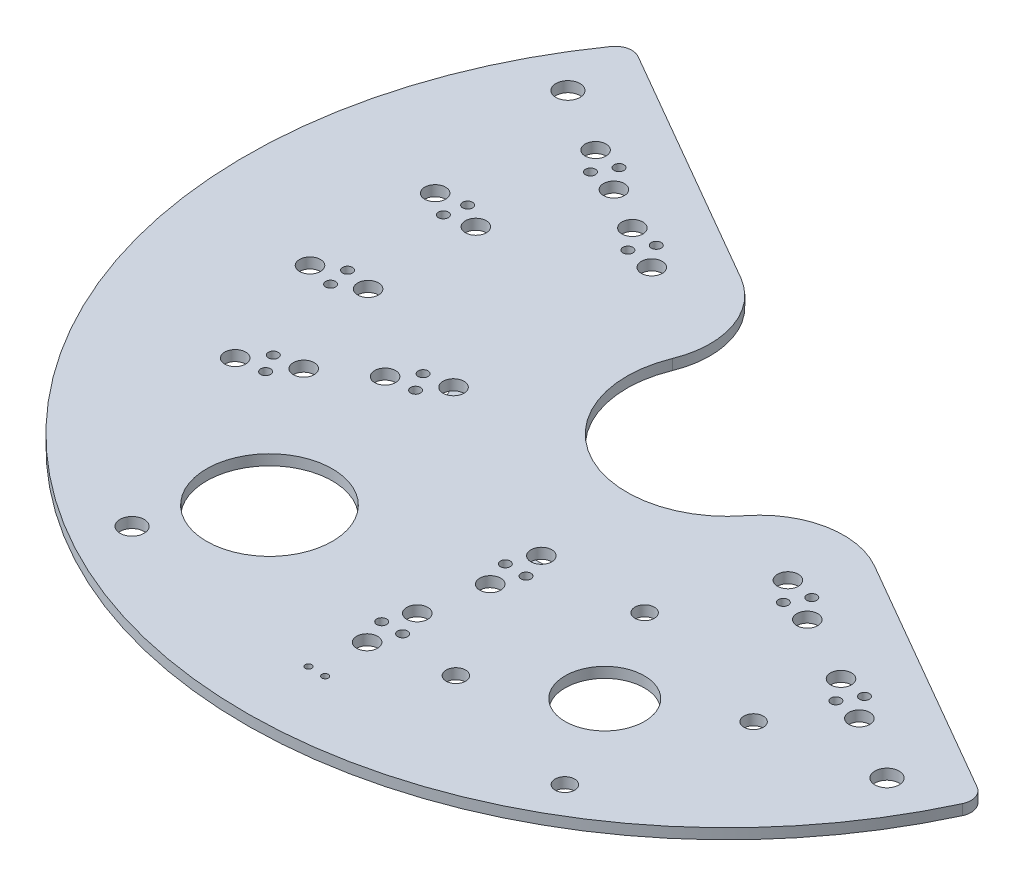
from build123d import *

# Parameters (mm, degrees)
SKETCH1_R           = 73.025
SKETCH1_R_2         = 15.24
SKETCH1_R_3         = 0.75
SKETCH1_R_4         = 1.585
SKETCH1_R_5         = 20
SKETCH1_R_6         = 9.525
SKETCH1_R_7         = 6
BOSS_EXTRUDE1_DEPTH = 1.5875
SKETCH2_R           = 1.8288
CUT_EXTRUDE1_DEPTH  = 104.285146107
CUT_EXTRUDE2_DEPTH  = 104.285146107
FILLET1_R           = 12.7
FILLET2_R           = 2.54
SKETCH4_R           = 0.4953
CUT_EXTRUDE3_DEPTH  = 104.285146107
SKETCH5_R           = 0.75
SKETCH5_R_2         = 0.4953
BOSS_EXTRUDE2_DEPTH = 0.1016
SKETCH6_R           = 1.4732
CUT_EXTRUDE4_DEPTH  = 104.285146107


with BuildPart() as part:
    # Sketch1 → Boss-Extrude1 (new body)
    with BuildSketch(Plane(origin=(0, 0, 0), x_dir=(1, 0, 0), z_dir=(0, 1, 0))):
        Circle(SKETCH1_R)
        Circle(SKETCH1_R_2, mode=Mode.SUBTRACT)
        with Locations((-1.585, 50.8)):
            Circle(SKETCH1_R_3, mode=Mode.SUBTRACT)
        with Locations((1.585, 50.8)):
            Circle(SKETCH1_R_3, mode=Mode.SUBTRACT)
        with Locations((0, 54.6)):
            Circle(SKETCH1_R_4, mode=Mode.SUBTRACT)
        with Locations((0, 47)):
            Circle(SKETCH1_R_4, mode=Mode.SUBTRACT)
        with Locations((47.284987047, 27.3)):
            Circle(SKETCH1_R_4, mode=Mode.SUBTRACT)
        with Locations((43.201590512, 26.772650265)):
            Circle(SKETCH1_R_3, mode=Mode.SUBTRACT)
        with Locations((44.786590512, 24.027349735)):
            Circle(SKETCH1_R_3, mode=Mode.SUBTRACT)
        with Locations((40.703193978, 23.5)):
            Circle(SKETCH1_R_4, mode=Mode.SUBTRACT)
        with Locations((47.284987047, -27.3)):
            Circle(SKETCH1_R_4, mode=Mode.SUBTRACT)
        with Locations((44.786590512, -24.027349735)):
            Circle(SKETCH1_R_3, mode=Mode.SUBTRACT)
        with Locations((43.201590512, -26.772650265)):
            Circle(SKETCH1_R_3, mode=Mode.SUBTRACT)
        with Locations((40.703193978, -23.5)):
            Circle(SKETCH1_R_4, mode=Mode.SUBTRACT)
        with Locations((0, -54.6)):
            Circle(SKETCH1_R_4, mode=Mode.SUBTRACT)
        with Locations((1.585, -50.8)):
            Circle(SKETCH1_R_3, mode=Mode.SUBTRACT)
        with Locations((-1.585, -50.8)):
            Circle(SKETCH1_R_3, mode=Mode.SUBTRACT)
        with Locations((0, -47)):
            Circle(SKETCH1_R_4, mode=Mode.SUBTRACT)
        with Locations((-47.284987047, -27.3)):
            Circle(SKETCH1_R_4, mode=Mode.SUBTRACT)
        with Locations((-43.201590512, -26.772650265)):
            Circle(SKETCH1_R_3, mode=Mode.SUBTRACT)
        with Locations((-44.786590512, -24.027349735)):
            Circle(SKETCH1_R_3, mode=Mode.SUBTRACT)
        with Locations((-40.703193978, -23.5)):
            Circle(SKETCH1_R_4, mode=Mode.SUBTRACT)
        with Locations((-47.284987047, 27.3)):
            Circle(SKETCH1_R_4, mode=Mode.SUBTRACT)
        with Locations((-44.786590512, 24.027349735)):
            Circle(SKETCH1_R_3, mode=Mode.SUBTRACT)
        with Locations((-43.201590512, 26.772650265)):
            Circle(SKETCH1_R_3, mode=Mode.SUBTRACT)
        with Locations((-40.703193978, 23.5)):
            Circle(SKETCH1_R_4, mode=Mode.SUBTRACT)
        with Locations((25.4, 43.994090512)):
            Circle(SKETCH1_R_5, mode=Mode.SUBTRACT)
        with Locations((-25.4, -43.994090512)):
            Circle(SKETCH1_R_6, mode=Mode.SUBTRACT)
        with Locations((25.4, -43.994090512)):
            Circle(SKETCH1_R_7, mode=Mode.SUBTRACT)
        with Locations((-46.285964392, 8.16146435)):
            Circle(SKETCH1_R_4, mode=Mode.SUBTRACT)
        with Locations((-50.303466215, 7.260407137)):
            Circle(SKETCH1_R_3, mode=Mode.SUBTRACT)
        with Locations((-49.753001491, 10.382247714)):
            Circle(SKETCH1_R_3, mode=Mode.SUBTRACT)
        with Locations((-53.770503314, 9.481190501)):
            Circle(SKETCH1_R_4, mode=Mode.SUBTRACT)
        with Locations((-46.285964392, -8.16146435)):
            Circle(SKETCH1_R_4, mode=Mode.SUBTRACT)
        with Locations((-49.753001491, -10.382247714)):
            Circle(SKETCH1_R_3, mode=Mode.SUBTRACT)
        with Locations((-50.303466215, -7.260407137)):
            Circle(SKETCH1_R_3, mode=Mode.SUBTRACT)
        with Locations((-53.770503314, -9.481190501)):
            Circle(SKETCH1_R_4, mode=Mode.SUBTRACT)
        with Locations((-29.397305699, -17.855276467)):
            Circle(SKETCH1_R_3, mode=Mode.SUBTRACT)
        with Locations((-31.002036221, -15.116847022)):
            Circle(SKETCH1_R_3, mode=Mode.SUBTRACT)
        with Locations((-33.503208801, -18.377965576)):
            Circle(SKETCH1_R_4, mode=Mode.SUBTRACT)
        with Locations((-26.914267425, -14.590346807)):
            Circle(SKETCH1_R_4, mode=Mode.SUBTRACT)
        with Locations((0.18310412, -33.841026905)):
            Circle(SKETCH1_R_3, mode=Mode.SUBTRACT)
        with Locations((3.356893615, -33.875899805)):
            Circle(SKETCH1_R_3, mode=Mode.SUBTRACT)
        with Locations((1.849768537, -30.052376234)):
            Circle(SKETCH1_R_4, mode=Mode.SUBTRACT)
        with Locations((1.702835812, -37.650969207)):
            Circle(SKETCH1_R_4, mode=Mode.SUBTRACT)
        with Locations((26.301300673, -17.833485437)):
            Circle(SKETCH1_R_3, mode=Mode.SUBTRACT)
        with Locations((27.822095531, -15.047567477)):
            Circle(SKETCH1_R_3, mode=Mode.SUBTRACT)
        with Locations((23.738572232, -14.583244351)):
            Circle(SKETCH1_R_4, mode=Mode.SUBTRACT)
        with Locations((30.37875087, -18.280301565)):
            Circle(SKETCH1_R_4, mode=Mode.SUBTRACT)
        with Locations((-31.702589396, 16.60915453)):
            Circle(SKETCH1_R_3, mode=Mode.SUBTRACT)
        with Locations((-30.181794538, 19.39507249)):
            Circle(SKETCH1_R_3, mode=Mode.SUBTRACT)
        with Locations((-34.265317837, 19.859395616)):
            Circle(SKETCH1_R_4, mode=Mode.SUBTRACT)
        with Locations((-27.625139199, 16.162338402)):
            Circle(SKETCH1_R_4, mode=Mode.SUBTRACT)
    extrude(amount=-BOSS_EXTRUDE1_DEPTH)

    # Sketch2 → Cut-Extrude1 (cut, through all)
    with BuildSketch(Plane(origin=(0, 0, 0), x_dir=(1, 0, 0), z_dir=(0, 1, 0))):
        with Locations((-57.192317666, 33.02)):
            Circle(SKETCH2_R)
        with Locations((33.02, 57.192317666)):
            Circle(SKETCH2_R)
        with Locations((57.192317666, -33.02)):
            Circle(SKETCH2_R)
        with Locations((-33.02, -57.192317666)):
            Circle(SKETCH2_R)
    extrude(amount=-CUT_EXTRUDE1_DEPTH, mode=Mode.SUBTRACT)

    # Sketch3 → Cut-Extrude2 (cut, through all)
    with BuildSketch(Plane(origin=(0, 0, 0), x_dir=(1, 0, 0), z_dir=(0, 1, 0))):
        with BuildLine():
            Line((-59.533825484, 44.637157955), (68.423825484, -29.239226276))
            ThreePointArc((68.423825484, -29.239226276), (37.204677955, 64.440392498), (-59.533825484, 44.637157955))
        make_face()
    extrude(amount=-CUT_EXTRUDE2_DEPTH, mode=Mode.SUBTRACT)

    # Fillet1
    fillet1_edges = [part.edges().sort_by_distance(p)[0] for p in [
        (15.165033815, -0.79375, -1.509751431),
        (-6.275033815, -0.79375, -13.888180249),
    ]]
    fillet(fillet1_edges, radius=FILLET1_R)

    # Fillet2
    fillet2_edges = [part.edges().sort_by_distance(p)[0] for p in [
        (67.216123088, -0.79375, 28.541958973),
        (-58.326123088, -0.79375, -43.939890652),
    ]]
    fillet(fillet2_edges, radius=FILLET2_R)

    # Sketch4 → Cut-Extrude3 (cut, through all)
    with BuildSketch(Plane(origin=(0, 0, 0), x_dir=(1, 0, 0), z_dir=(0, 1, 0))):
        with Locations((1.27, -62.23)):
            Circle(SKETCH4_R)
        with Locations((-1.27, -62.23)):
            Circle(SKETCH4_R)
    extrude(amount=-CUT_EXTRUDE3_DEPTH, mode=Mode.SUBTRACT)

    # Sketch5 → Boss-Extrude2 (add)
    # profile 1 of 7: a face of its own
    with BuildSketch(Plane.XZ.offset(1.5875)):
        with BuildLine():
            Line((30.413547782, 24.598324481), (41.535902061, 31.019818718))
            ThreePointArc((41.535902061, 31.019818718), (42.622921377, 29.508420604), (43.654971217, 27.958966385))
            ThreePointArc((43.654971217, 27.958966385), (43.878655246, 25.698181398), (41.935772719, 26.875632368))
            ThreePointArc((41.935772719, 26.875632368), (41.454257835, 27.61255432), (40.959794735, 28.340851504))
            Line((40.959794735, 28.340851504), (29.89025274, 21.949848454))
            ThreePointArc((29.89025274, 21.949848454), (18.542, 32.115686074), (4.064, 36.860642425))
            Line((4.064, 36.860642425), (4.064, 49.642648525))
            ThreePointArc((4.064, 49.642648525), (3.186044586, 49.706717539), (2.307094012, 49.755260685))
            ThreePointArc((2.307094012, 49.755260685), (0.315950299, 50.849120827), (2.385689544, 51.785797268))
            ThreePointArc((2.385689544, 51.785797268), (4.24358118, 51.666742998), (6.096, 51.481055713))
            Line((6.096, 51.481055713), (6.096, 38.638067239))
            ThreePointArc((6.096, 38.638067239), (19.558, 33.875449694), (30.413547782, 24.598324481))
        make_face()
        with Locations((1.585, 50.8)):
            Circle(SKETCH5_R, mode=Mode.SUBTRACT)
        with Locations((43.201590512, 26.772650265)):
            Circle(SKETCH5_R, mode=Mode.SUBTRACT)
    # profile 2 of 7: a face of its own
    with BuildSketch(Plane.XZ.offset(1.5875)):
        with BuildLine():
            Line((28.012465947, 9.133950273), (57.7422016, 26.298421156))
            ThreePointArc((57.7422016, 26.298421156), (34.873073505, 53.006014236), (1.294606888, 63.435737514))
            ThreePointArc((1.294606888, 63.435737514), (0.064262486, 62.254606888), (1.245393112, 61.024262486))
            ThreePointArc((1.245393112, 61.024262486), (32.789239067, 51.481816376), (54.774266163, 26.931234326))
            Line((54.774266163, 26.931234326), (46.78921353, 22.321062039))
            ThreePointArc((46.78921353, 22.321062039), (46.421042914, 23.07698178), (46.040660761, 23.826830883))
            ThreePointArc((46.040660761, 23.826830883), (44.194605545, 25.150939428), (44.242866733, 22.879628318))
            ThreePointArc((44.242866733, 22.879628318), (44.640302422, 22.09416322), (45.023794735, 21.301797022))
            Line((45.023794735, 21.301797022), (29.080316768, 12.096825726))
            ThreePointArc((29.080316768, 12.096825726), (-15.748, 27.276336118), (-25.016316768, -19.135880208))
            Line((-25.016316768, -19.135880208), (-40.959794735, -28.340851504))
            ThreePointArc((-40.959794735, -28.340851504), (-41.454257835, -27.61255432), (-41.935772719, -26.875632369))
            ThreePointArc((-41.935772719, -26.875632369), (-43.878655246, -25.698181398), (-43.654971217, -27.958966385))
            ThreePointArc((-43.654971217, -27.958966385), (-42.622921377, -29.508420604), (-41.535902061, -31.019818718))
            Line((-41.535902061, -31.019818718), (-21.916465947, -19.692531996))
            ThreePointArc((-21.916465947, -19.692531996), (-14.732, 25.516572497), (28.012465947, 9.133950273))
        make_face()
        with Locations((1.27, 62.23)):
            Circle(SKETCH5_R_2, mode=Mode.SUBTRACT)
        with Locations((44.786590512, 24.027349735)):
            Circle(SKETCH5_R, mode=Mode.SUBTRACT)
        with Locations((-43.201590512, -26.772650265)):
            Circle(SKETCH5_R, mode=Mode.SUBTRACT)
    # profile 3 of 7: a face of its own
    with BuildSketch(Plane.XZ.offset(1.5875)):
        with BuildLine():
            Line((-6.096, 38.638067239), (-6.096, 51.481055713))
            ThreePointArc((-6.096, 51.481055713), (-4.24358118, 51.666742998), (-2.385689544, 51.785797268))
            ThreePointArc((-2.385689544, 51.785797268), (-0.315950299, 50.849120827), (-2.307094012, 49.755260685))
            ThreePointArc((-2.307094012, 49.755260685), (-3.186044586, 49.706717539), (-4.064, 49.642648525))
            Line((-4.064, 49.642648525), (-4.064, 36.860642425))
            ThreePointArc((-4.064, 36.860642425), (-18.542, 32.115686074), (-29.89025274, 21.949848454))
            Line((-29.89025274, 21.949848454), (-40.959794734, 28.340851504))
            ThreePointArc((-40.959794734, 28.340851504), (-41.454257834, 27.612554318), (-41.935772719, 26.875632366))
            ThreePointArc((-41.935772719, 26.875632366), (-43.878655247, 25.698181399), (-43.654971218, 27.958966385))
            ThreePointArc((-43.654971218, 27.958966385), (-42.622921377, 29.508420604), (-41.535902061, 31.019818718))
            Line((-41.535902061, 31.019818718), (-30.413547782, 24.598324481))
            ThreePointArc((-30.413547782, 24.598324481), (-19.558, 33.875449694), (-6.096, 38.638067239))
        make_face()
        with Locations((-1.585, 50.8)):
            Circle(SKETCH5_R, mode=Mode.SUBTRACT)
        with Locations((-43.201590512, 26.772650265)):
            Circle(SKETCH5_R, mode=Mode.SUBTRACT)
    # profile 4 of 7: a face of its own
    with BuildSketch(Plane.XZ.offset(1.5875)):
        with BuildLine():
            ThreePointArc((-1.137328397, 61.026372169), (-0.059313178, 62.253645904), (-1.184427719, 63.437890349))
            ThreePointArc((-1.184427719, 63.437890349), (-54.638937722, 32.254538991), (-56.114446604, -29.613133627))
            ThreePointArc((-56.114446604, -29.613133627), (-54.535716158, -29.885091506), (-54.048929792, -28.358857598))
            ThreePointArc((-54.048929792, -28.358857598), (-52.52438099, 31.091815927), (-1.137328397, 61.026372169))
        make_face()
        with Locations((-1.27, 62.23)):
            Circle(SKETCH5_R_2, mode=Mode.SUBTRACT)
    # profile 5 of 7: a face of its own
    with BuildSketch(Plane.XZ.offset(1.5875)):
        with BuildLine():
            ThreePointArc((-48.598743805, -10.911954419), (-50.02174423, -9.141007471), (-50.584784004, -11.341954884))
            ThreePointArc((-50.584784004, -11.341954884), (-48.714342613, -17.730570693), (-46.040660762, -23.826830883))
            ThreePointArc((-46.040660762, -23.826830883), (-44.194605545, -25.150939428), (-44.242866733, -22.879628318))
            ThreePointArc((-44.242866733, -22.879628318), (-46.804887207, -17.035585761), (-48.598743805, -10.911954419))
        make_face()
        with Locations((-49.753001492, -10.382247714)):
            Circle(SKETCH5_R, mode=Mode.SUBTRACT)
        with Locations((-44.786590512, -24.027349735)):
            Circle(SKETCH5_R, mode=Mode.SUBTRACT)
    # profile 6 of 7: a face of its own
    with BuildSketch(Plane.XZ.offset(1.5875)):
        with BuildLine():
            ThreePointArc((-51.413325287, -6.643063765), (-50.131472617, -8.518706863), (-49.399989148, -6.367866276))
            ThreePointArc((-49.399989148, -6.367866276), (-49.808720609, 0), (-49.399989147, 6.367866276))
            ThreePointArc((-49.399989147, 6.367866276), (-50.131472618, 8.518706864), (-51.413325287, 6.643063765))
            ThreePointArc((-51.413325287, 6.643063765), (-51.840720609, 0), (-51.413325287, -6.643063765))
        make_face()
        with Locations((-50.303466215, 7.260407137)):
            Circle(SKETCH5_R, mode=Mode.SUBTRACT)
        with Locations((-50.303466215, -7.260407137)):
            Circle(SKETCH5_R, mode=Mode.SUBTRACT)
    # profile 7 of 7: a face of its own
    with BuildSketch(Plane.XZ.offset(1.5875)):
        with BuildLine():
            ThreePointArc((-50.584784004, 11.341954884), (-50.021744231, 9.141007472), (-48.598743805, 10.911954418))
            ThreePointArc((-48.598743805, 10.911954418), (-46.804887206, 17.035585761), (-44.242866731, 22.879628319))
            ThreePointArc((-44.242866731, 22.879628319), (-44.194605545, 25.150939428), (-46.040660762, 23.826830883))
            ThreePointArc((-46.040660762, 23.826830883), (-46.866502558, 22.158322394), (-47.631902061, 20.461236995))
            ThreePointArc((-47.631902061, 20.461236995), (-49.319566928, 15.969991589), (-50.584784004, 11.341954884))
        make_face()
        with Locations((-44.786590512, 24.027349735)):
            Circle(SKETCH5_R, mode=Mode.SUBTRACT)
        with Locations((-49.753001492, 10.382247714)):
            Circle(SKETCH5_R, mode=Mode.SUBTRACT)
    extrude(amount=BOSS_EXTRUDE2_DEPTH)

    # Sketch6 → Cut-Extrude4 (cut, through all)
    with BuildSketch(Plane.XZ.offset(1.5875)):
        with Locations((33.655, 58.292169929)):
            Circle(SKETCH6_R)
        with Locations((11.101920584, 52.249090512)):
            Circle(SKETCH6_R)
        with Locations((17.145, 29.696011096)):
            Circle(SKETCH6_R)
        with Locations((39.698079417, 35.739090512)):
            Circle(SKETCH6_R)
    extrude(amount=-CUT_EXTRUDE4_DEPTH, mode=Mode.SUBTRACT)


solid = part.part
